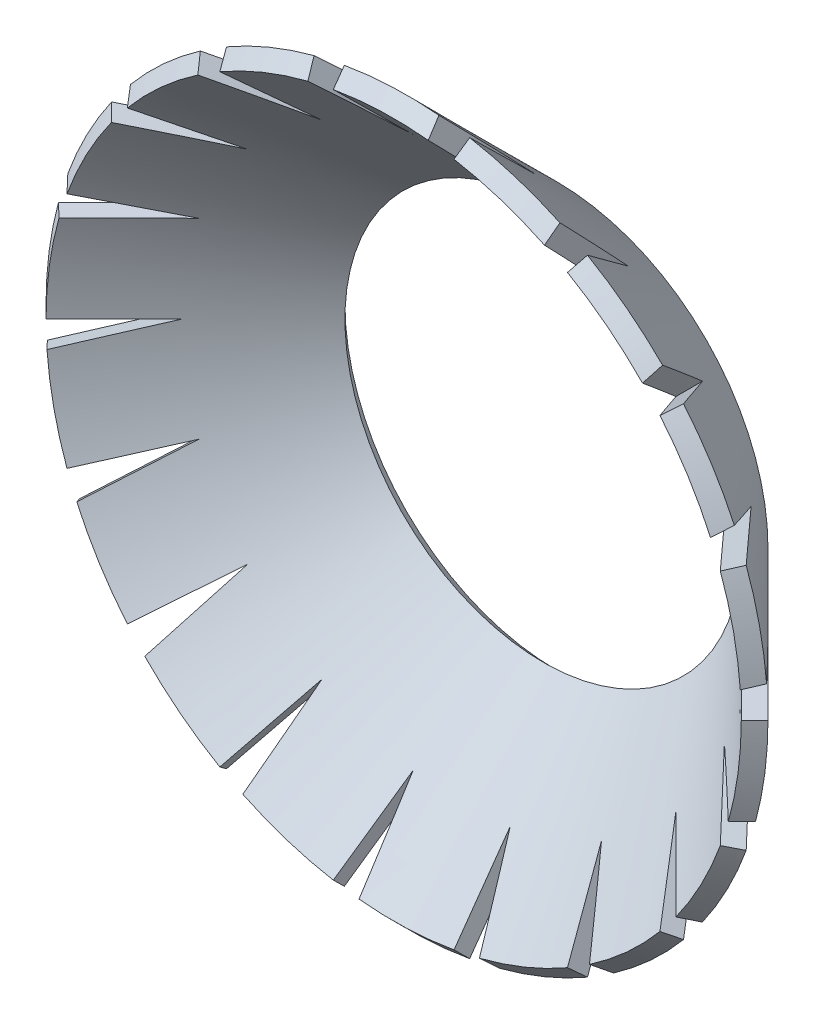
from build123d import *

# Parameters (mm, degrees)
TOOTHCUT_DEPTH = 12.272794032
TOOTHPAT_COUNT = 18


with BuildPart() as part:
    # BodySke → BaseBody (revolve)
    with BuildSketch(Plane(origin=(0, 0, 0), x_dir=(1, 0, 0), z_dir=(0, 1, 0))):
        Polygon((7.65, 0), (4.482842712, 3.167157288), (4.2, 2.884314575), (7.367157288, -0.282842712), align=None)
    revolve(axis=Axis((0, 0, 1.599979551), (0, 0, -1)))

    # ToothSke → ToothCut (cut, symmetric)
    with BuildSketch(Plane.XY):
        Polygon((7.65, 0), (7.65, 0.667588439), (5.925, 0), align=None)
    toothcut = extrude(amount=TOOTHCUT_DEPTH, both=True, mode=Mode.SUBTRACT)

    # ToothPat: ToothCut ×18 about axis
    toothpat_axis = Axis((0, 0, 1.599979551), (0, 0, -1))
    for i in range(1, TOOTHPAT_COUNT):
        add(toothcut.rotate(toothpat_axis, i * 360 / TOOTHPAT_COUNT), mode=Mode.SUBTRACT)


solid = part.part
